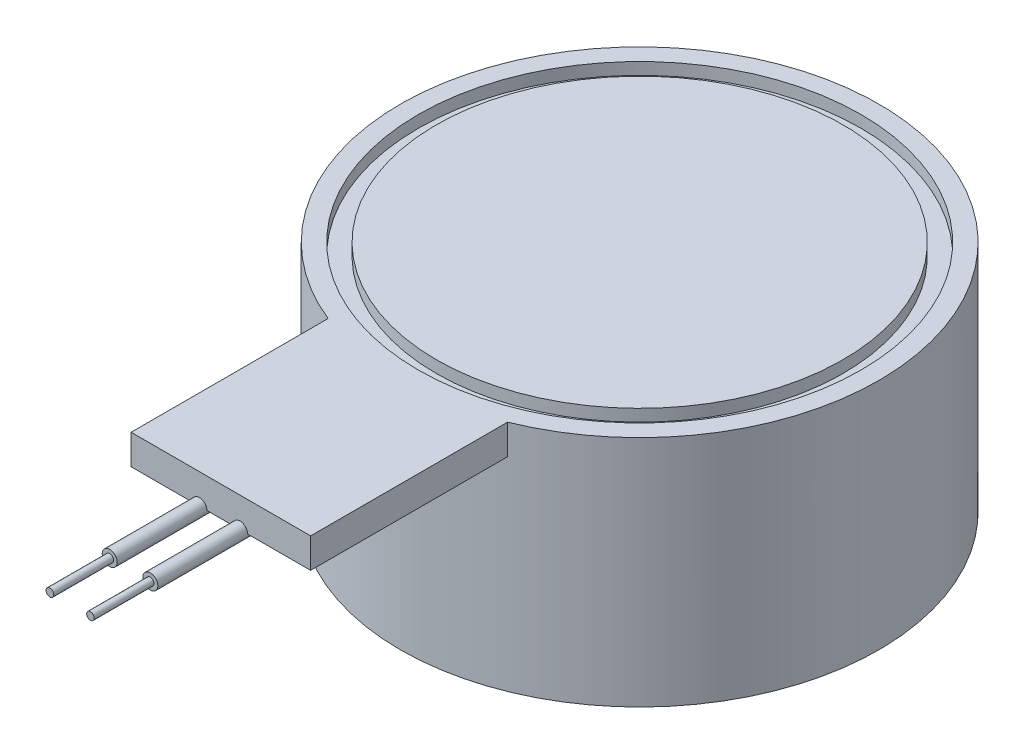
from build123d import *

# Parameters (mm, degrees)
SKETCH1_R               = 4
BOSS_EXTRUDE3_DEPTH     = 3.4
BOSS_EXTRUDE5_START     = 0.5
SKETCH3_R               = 4
BOSS_EXTRUDE5_DEPTH     = 0.5
BOSS_EXTRUDE6_DEPTH     = 0.5
SKETCH8_R               = 0.125
BOSS_EXTRUDE10_DEPTH    = 1.5
SKETCH9_R               = 0.0625
SKETCH9_R_2             = 0.065
BOSS_EXTRUDE11_DEPTH    = 1
CONG_1_R                = 1
ESQUISSE1_R             = 3.7
ESQUISSE1_R_2           = 3.4
ENL_V_MAT_EXTRU_1_DEPTH = 0.2


with BuildPart() as part:
    # Sketch1 → Boss-Extrude3 (new body)
    with BuildSketch(Plane(origin=(0, 0, 0), x_dir=(1, 0, 0), z_dir=(0, 1, 0))):
        with Locations(Location((2.012990556, 4.989015145, 0), (0, 0, 270))):
            Circle(SKETCH1_R)
    extrude(amount=-BOSS_EXTRUDE3_DEPTH)

    # Sketch3 → Boss-Extrude5 (add)
    with BuildSketch(Plane(origin=(0, 0, 0), x_dir=(1, 0, 0), z_dir=(0, 1, 0)).offset(BOSS_EXTRUDE5_START)):
        with Locations(Location((2.012990556, 4.989015145, 0), (0, 0, 270))):
            Circle(SKETCH3_R)
    extrude(amount=-BOSS_EXTRUDE5_DEPTH)

    # Sketch5 → Boss-Extrude6 (add)
    with BuildSketch(Plane(origin=(0, 0.5, 0), x_dir=(1, 0, 0), z_dir=(0, 1, 0))):
        with BuildLine():
            ThreePointArc((3.512990556, 1.280915901), (2.012990556, 0.989015145), (0.512990556, 1.280915901))
            Line((0.512990556, 1.280915901), (0.512990556, -2.010984855))
            Line((0.512990556, -2.010984855), (3.512990556, -2.010984855))
            Line((3.512990556, -2.010984855), (3.512990556, 1.280915901))
        make_face()
    extrude(amount=-BOSS_EXTRUDE6_DEPTH)

    # Sketch8 → Boss-Extrude10 (add)
    with BuildSketch(Plane.XY.offset(2.010984855)):
        with Locations((2.334197454, 0)):
            Circle(SKETCH8_R)
        with Locations((1.65473302, 0)):
            Circle(SKETCH8_R)
    extrude(amount=BOSS_EXTRUDE10_DEPTH)

    # Sketch9 → Boss-Extrude11 (add)
    with BuildSketch(Plane.XY.offset(3.510984855)):
        with Locations((2.332150334, 0)):
            Circle(SKETCH9_R)
        with Locations((1.65473302, 0)):
            Circle(SKETCH9_R_2)
    extrude(amount=BOSS_EXTRUDE11_DEPTH)

    # Congé1
    # the kernel refuses this fillet: 1 mm, written as the material it adds along each edge
    with BuildSketch(Plane(origin=(-0.290802546, 0, 2.010984855), x_dir=(0, 0, -1), z_dir=(1, 0, 0))) as cong_1_piece_1_section:
        with BuildLine():
            CenterArc((CONG_1_R, -CONG_1_R), CONG_1_R, 90, 90)
            Line((0, -CONG_1_R), (0, 0))
            Line((0, 0), (CONG_1_R, 0))
        make_face()
    cong_1_piece_1 = extrude(amount=5.25, mode=Mode.PRIVATE)
    cong_1_piece_1 = cong_1_piece_1 & Plane(origin=(2.334197454, 0, 1.652352457), x_dir=(1, 0, 0), z_dir=(0, 0, -1)) * Cylinder(0.125, 15, mode=Mode.PRIVATE)
    add(cong_1_piece_1)
    with BuildSketch(Plane(origin=(-0.290802546, 0, 2.010984855), x_dir=(0, 0, -1), z_dir=(1, 0, 0))) as cong_1_piece_2_section:
        with BuildLine():
            CenterArc((CONG_1_R, -CONG_1_R), CONG_1_R, 90, 90)
            Line((0, -CONG_1_R), (0, 0))
            Line((0, 0), (CONG_1_R, 0))
        make_face()
    cong_1_piece_2 = extrude(amount=5.25, mode=Mode.PRIVATE)
    cong_1_piece_2 = cong_1_piece_2 & Plane(origin=(1.65473302, 0, 1.652352457), x_dir=(1, 0, 0), z_dir=(0, 0, -1)) * Cylinder(0.125, 15, mode=Mode.PRIVATE)
    add(cong_1_piece_2)
    with BuildSketch(Plane(origin=(-0.97026698, 0, 2.010984855), x_dir=(0, 0, -1), z_dir=(1, 0, 0))) as cong_1_piece_3_section:
        with BuildLine():
            CenterArc((CONG_1_R, -CONG_1_R), CONG_1_R, 90, 90)
            Line((0, -CONG_1_R), (0, 0))
            Line((0, 0), (CONG_1_R, 0))
        make_face()
    cong_1_piece_3 = extrude(amount=5.25, mode=Mode.PRIVATE)
    cong_1_piece_3 = cong_1_piece_3 & Plane(origin=(2.334197454, 0, 1.652352457), x_dir=(1, 0, 0), z_dir=(0, 0, -1)) * Cylinder(0.125, 15, mode=Mode.PRIVATE)
    add(cong_1_piece_3)
    with BuildSketch(Plane(origin=(-0.97026698, 0, 2.010984855), x_dir=(0, 0, -1), z_dir=(1, 0, 0))) as cong_1_piece_4_section:
        with BuildLine():
            CenterArc((CONG_1_R, -CONG_1_R), CONG_1_R, 90, 90)
            Line((0, -CONG_1_R), (0, 0))
            Line((0, 0), (CONG_1_R, 0))
        make_face()
    cong_1_piece_4 = extrude(amount=5.25, mode=Mode.PRIVATE)
    cong_1_piece_4 = cong_1_piece_4 & Plane(origin=(1.65473302, 0, 1.652352457), x_dir=(1, 0, 0), z_dir=(0, 0, -1)) * Cylinder(0.125, 15, mode=Mode.PRIVATE)
    add(cong_1_piece_4)

    # Esquisse1 → Enlèv. mat.-Extru.1 (cut)
    with BuildSketch(Plane(origin=(0, 0.5, 0), x_dir=(1, 0, 0), z_dir=(0, 1, 0))):
        with Locations(Location((2.012990556, 4.989015145, 0), (0, 0, 270))):
            Circle(ESQUISSE1_R)
        with Locations(Location((2.012990556, 4.989015145, 0), (0, 0, 270))):
            Circle(ESQUISSE1_R_2, mode=Mode.SUBTRACT)
    extrude(amount=-ENL_V_MAT_EXTRU_1_DEPTH, mode=Mode.SUBTRACT)


solid = part.part
